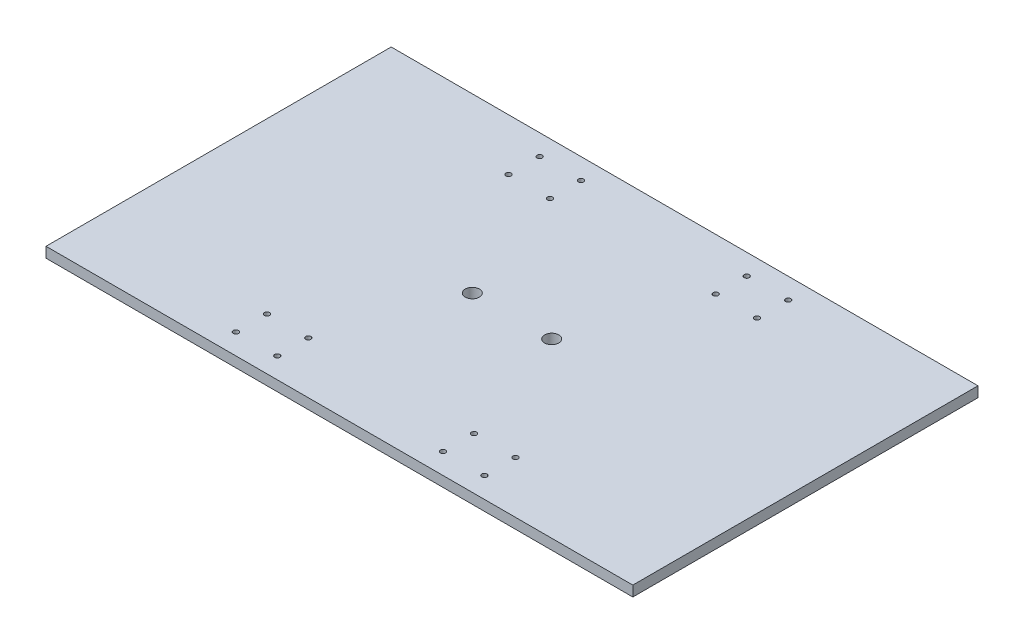
from build123d import *

# Parameters (mm, degrees)
SKETCH1_W           = 340
SKETCH1_H           = 200
SKETCH1_R           = 4.1
SKETCH1_R_2         = 1.5
BOSS_EXTRUDE1_DEPTH = 6


with BuildPart() as part:
    # Sketch1 → Boss-Extrude1 (new body)
    with BuildSketch(Plane(origin=(0, 0, 0), x_dir=(1, 0, 0), z_dir=(0, 1, 0))):
        Rectangle(SKETCH1_W, SKETCH1_H)
        with Locations((-23, 0)):
            Circle(SKETCH1_R, mode=Mode.SUBTRACT)
        with Locations((23, 0)):
            Circle(SKETCH1_R, mode=Mode.SUBTRACT)
        with Locations((72, 88)):
            Circle(SKETCH1_R_2, mode=Mode.SUBTRACT)
        with Locations((48, 88)):
            Circle(SKETCH1_R_2, mode=Mode.SUBTRACT)
        with Locations((72, 70)):
            Circle(SKETCH1_R_2, mode=Mode.SUBTRACT)
        with Locations((48, 70)):
            Circle(SKETCH1_R_2, mode=Mode.SUBTRACT)
        with Locations((-48, 70)):
            Circle(SKETCH1_R_2, mode=Mode.SUBTRACT)
        with Locations((-72, 70)):
            Circle(SKETCH1_R_2, mode=Mode.SUBTRACT)
        with Locations((-48, 88)):
            Circle(SKETCH1_R_2, mode=Mode.SUBTRACT)
        with Locations((-72, 88)):
            Circle(SKETCH1_R_2, mode=Mode.SUBTRACT)
        with Locations((-72, -88)):
            Circle(SKETCH1_R_2, mode=Mode.SUBTRACT)
        with Locations((-48, -88)):
            Circle(SKETCH1_R_2, mode=Mode.SUBTRACT)
        with Locations((-72, -70)):
            Circle(SKETCH1_R_2, mode=Mode.SUBTRACT)
        with Locations((-48, -70)):
            Circle(SKETCH1_R_2, mode=Mode.SUBTRACT)
        with Locations((48, -70)):
            Circle(SKETCH1_R_2, mode=Mode.SUBTRACT)
        with Locations((72, -70)):
            Circle(SKETCH1_R_2, mode=Mode.SUBTRACT)
        with Locations((48, -88)):
            Circle(SKETCH1_R_2, mode=Mode.SUBTRACT)
        with Locations((72, -88)):
            Circle(SKETCH1_R_2, mode=Mode.SUBTRACT)
    extrude(amount=BOSS_EXTRUDE1_DEPTH)


solid = part.part
